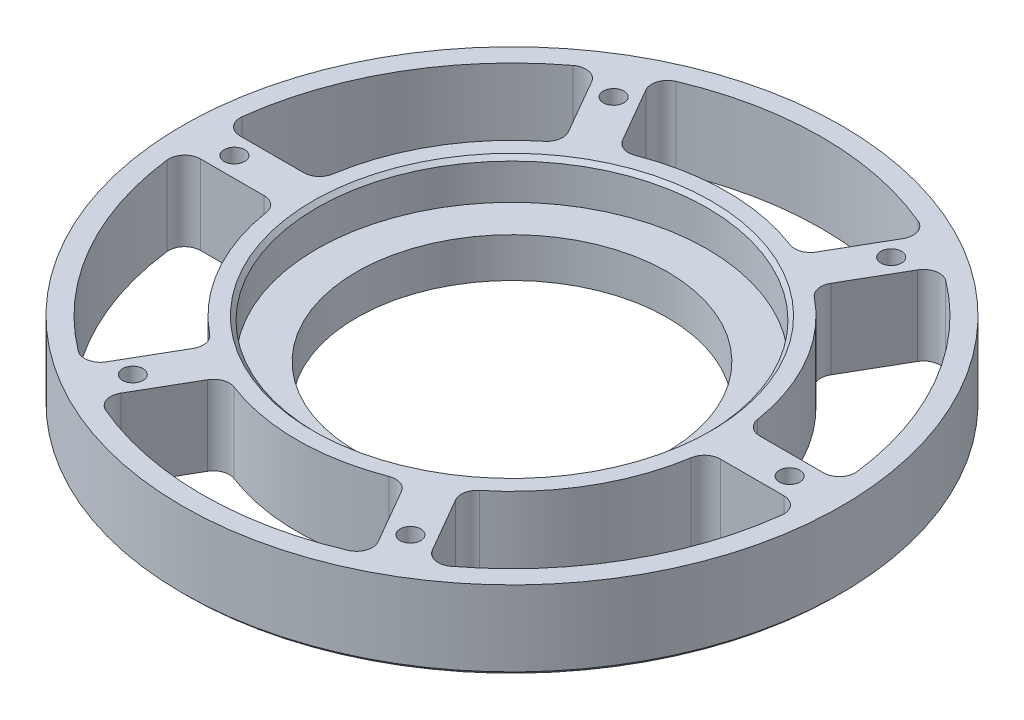
from build123d import *

# Parameters (mm, degrees)
F_6_0_204_DIAMETER_HOLE1_D = 5.1816
CIRPATTERN3_COUNT          = 6
CUT_EXTRUDE1_DEPTH         = 120.21069618124123
FILLET1_R                  = 4
CIRPATTERN4_COUNT          = 6
FILLET1_OF_CIRPATTERN4_R   = 4
CHAMFER1_SIZE              = 1
CHAMFER2_SIZE              = 1


with BuildPart() as part:
    # Sketch2 → Revolve1 (revolve)
    with BuildSketch(Plane(origin=(0, 0, 0), x_dir=(0, 0, -1), z_dir=(1, 0, 0))):
        Polygon((-39.2125, -8.7e-16), (-83.09991000000001, -5.37e-15), (-83.09991000000001, 19.999999999999993), (-49.2125, 19.999999999999993), (-49.21250000000001, 9.999999999999993), (-39.21250000000001, 9.999999999999991), align=None)
    revolve(axis=Axis((0, -1.000000000000006, 0), (0, 1, 0)))

    # #6 (0.204) Diameter Hole1 (through all)
    with Locations(Plane(origin=(0, 19.999999999999993, 0), x_dir=(1, 0, 0), z_dir=(0, 1, 0))):
        with Locations((-35, 60.621778265)):
            f_6_0_204_diameter_hole1 = Hole(F_6_0_204_DIAMETER_HOLE1_D / 2)

    # CirPattern3: #6 (0.204) Diameter Hole1 ×6 about axis
    cirpattern3_axis = Axis((0, -1.000000000000006, 0), (0, 1, 0))
    for i in range(1, CIRPATTERN3_COUNT):
        add(f_6_0_204_diameter_hole1.rotate(cirpattern3_axis, i * 360 / CIRPATTERN3_COUNT), mode=Mode.SUBTRACT)

    # Sketch8 → Cut-Extrude1 (cut, through all)
    with BuildSketch(Plane(origin=(0, 19.999999999999993, 0), x_dir=(1, 0, 0), z_dir=(0, 1, 0))):
        with BuildLine():
            Line((-34.63972011321362, 69.99775519605127), (-22.660589701137393, 49.249292691841845))
            ThreePointArc((-22.660589701137393, 49.249292691841845), (3.32e-15, 54.212500000000006), (22.660589701137393, 49.249292691841845))
            Line((22.660589701137393, 49.249292691841845), (34.63972011321362, 69.99775519605127))
            ThreePointArc((34.63972011321362, 69.99775519605127), (4.78e-15, 78.09991), (-34.63972011321362, 69.99775519605127))
        make_face()
    cut_extrude1 = extrude(amount=-CUT_EXTRUDE1_DEPTH, mode=Mode.SUBTRACT)

    # Fillet1
    fillet1_edges = [part.edges().sort_by_distance(p)[0] for p in [
        (34.63972011321362, 9.999999999999996, -69.99775519605126),
        (22.660589701137397, 9.999999999999996, -49.249292691841845),
        (-34.63972011321361, 9.999999999999996, -69.99775519605126),
        (-22.660589701137393, 9.999999999999996, -49.249292691841845),
    ]]
    fillet(fillet1_edges, radius=FILLET1_R)

    # CirPattern4: Cut-Extrude1 ×6 about axis
    cirpattern4_axis = Axis((0, -1.000000000000006, 0), (0, 1, 0))
    for i in range(1, CIRPATTERN4_COUNT):
        add(cut_extrude1.rotate(cirpattern4_axis, i * 360 / CIRPATTERN4_COUNT), mode=Mode.SUBTRACT)

    # Fillet1 of CirPattern4
    fillet1_of_cirpattern4_edges = [part.edges().sort_by_distance(p)[0] for p in [
        (-43.29997415105776, 9.999999999999996, -64.9977551960514),
        (-31.320843738981637, 9.999999999999996, -44.24929269184193),
        (-77.93969426427138, 9.999999999999996, -4.999999999999879),
        (-53.981433440119034, 9.999999999999996, -4.999999999999929),
        (-77.93969426427138, 9.999999999999996, 4.999999999999847),
        (-53.981433440119034, 9.999999999999996, 4.999999999999904),
        (-43.29997415105778, 9.999999999999996, 64.99775519605137),
        (-31.32084373898165, 9.999999999999996, 44.249292691841916),
        (-34.63972011321363, 9.999999999999996, 69.99775519605126),
        (-22.660589701137404, 9.999999999999996, 49.249292691841845),
        (34.639720113213606, 9.999999999999996, 69.99775519605126),
        (22.660589701137386, 9.999999999999996, 49.249292691841845),
        (43.29997415105774, 9.999999999999996, 64.99775519605141),
        (31.320843738981612, 9.999999999999996, 44.249292691841944),
        (77.93969426427138, 9.999999999999996, 4.999999999999908),
        (53.98143344011903, 9.999999999999996, 4.999999999999947),
        (77.9396942642714, 9.999999999999996, -4.999999999999872),
        (53.981433440119034, 9.999999999999996, -4.999999999999925),
        (43.29997415105777, 9.999999999999996, -64.9977551960514),
        (31.320843738981637, 9.999999999999996, -44.24929269184193),
    ]]
    fillet(fillet1_of_cirpattern4_edges, radius=FILLET1_OF_CIRPATTERN4_R)

    # Chamfer1
    chamfer1_edges = [part.edges().sort_by_distance(p)[0] for p in [
        (6.03e-15, 19.999999999999993, -49.2125),
    ]]
    chamfer(chamfer1_edges, length=CHAMFER1_SIZE)

    # Chamfer2
    chamfer2_edges = [part.edges().sort_by_distance(p)[0] for p in [
        (1.018e-14, -5.33e-15, -83.09991000000001),
    ]]
    chamfer(chamfer2_edges, length=CHAMFER2_SIZE)


solid = part.part
